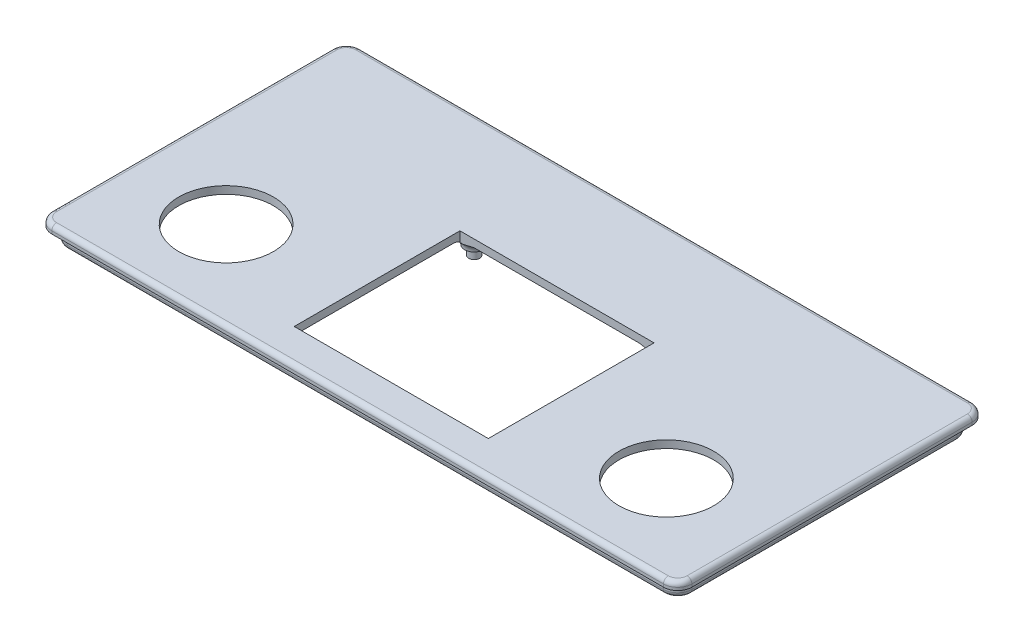
from build123d import *

# Parameters (mm, degrees)
SKETCH1_W           = 132
SKETCH1_H           = 62
SKETCH1_W_2         = 128.8
SKETCH1_H_2         = 58.8
BOSS_EXTRUDE1_DEPTH = 3
SKETCH3_W           = 135.2
SKETCH3_H           = 65.2
BOSS_EXTRUDE3_DEPTH = 1.6
FILLET2_R           = 3
CUT_EXTRUDE1_REACH  = 77.191
SKETCH4_R           = 10
FILLET3_R           = 1
FILLET4_R           = 1
CUT_EXTRUDE2_REACH  = 77.191
SKETCH5_W           = 41
SKETCH5_H           = 35
SKETCH6_R           = 2
BOSS_EXTRUDE4_DEPTH = 2
SKETCH7_R           = 1.15
BOSS_EXTRUDE5_DEPTH = 2
FILLET5_R           = 2


with BuildPart() as part:
    # Sketch1 → Boss-Extrude1 (new body)
    with BuildSketch(Plane(origin=(0, 0, 0), x_dir=(1, 0, 0), z_dir=(0, 1, 0))):
        Rectangle(SKETCH1_W, SKETCH1_H)
        Rectangle(SKETCH1_W_2, SKETCH1_H_2, mode=Mode.SUBTRACT)
    extrude(amount=BOSS_EXTRUDE1_DEPTH)

    # Sketch3 → Boss-Extrude3 (add)
    with BuildSketch(Plane(origin=(0, 3, 0), x_dir=(1, 0, 0), z_dir=(0, 1, 0))):
        Rectangle(SKETCH3_W, SKETCH3_H)
    extrude(amount=BOSS_EXTRUDE3_DEPTH)

    # Fillet2
    fillet2_edges = [part.edges().sort_by_distance(p)[0] for p in [
        (-64.4, 1.5, 29.4),
        (64.4, 1.5, 29.4),
        (64.4, 1.5, -29.4),
        (-64.4, 1.5, -29.4),
        (-67.6, 3.8, 32.6),
        (67.6, 3.8, 32.6),
        (67.6, 3.8, -32.6),
        (-67.6, 3.8, -32.6),
        (66, 1.5, 31),
        (-66, 1.5, 31),
        (-66, 1.5, -31),
        (66, 1.5, -31),
    ]]
    fillet(fillet2_edges, radius=FILLET2_R)

    # Sketch4 → Cut-Extrude1 (cut, up to next)
    with BuildSketch(Plane(origin=(0, 4.6, 0), x_dir=(1, 0, 0), z_dir=(0, 1, 0)), mode=Mode.PRIVATE) as cut_extrude1_sk1:
        with Locations(Location((-46.3929, -14, 0), (0, 0, 270))):
            Circle(SKETCH4_R)
    cut_extrude1_tool1 = extrude(cut_extrude1_sk1.sketch, amount=-CUT_EXTRUDE1_REACH, mode=Mode.PRIVATE) & part.part
    # Sketch4 → Cut-Extrude1 (cut, up to next)
    with BuildSketch(Plane(origin=(0, 4.6, 0), x_dir=(1, 0, 0), z_dir=(0, 1, 0)), mode=Mode.PRIVATE) as cut_extrude1_sk2:
        with Locations(Location((46.6071, -14, 0), (0, 0, 270))):
            Circle(SKETCH4_R)
    cut_extrude1_tool2 = extrude(cut_extrude1_sk2.sketch, amount=-CUT_EXTRUDE1_REACH, mode=Mode.PRIVATE) & part.part
    add(cut_extrude1_tool1.solids().sort_by_distance((-46.3929, 4.6, 14))[0], mode=Mode.SUBTRACT)
    add(cut_extrude1_tool2.solids().sort_by_distance((46.6071, 4.6, 14))[0], mode=Mode.SUBTRACT)

    # Fillet3
    fillet3_edges = [part.edges().sort_by_distance(p)[0] for p in [
        (0, 4.6, -32.6),
        (67.6, 4.6, 0),
        (0, 4.6, 32.6),
        (-67.6, 4.6, 0),
        (-66.721320344, 4.6, 31.721320344),
        (-66.721320344, 4.6, -31.721320344),
        (66.721320344, 4.6, 31.721320344),
        (66.721320344, 4.6, -31.721320344),
    ]]
    fillet(fillet3_edges, radius=FILLET3_R)

    # Fillet4
    fillet4_edges = [part.edges().sort_by_distance(p)[0] for p in [
        (0, 0, -31),
        (66, 0, 0),
        (0, 0, 31),
        (-66, 0, 0),
        (-65.121320344, 0, 30.121320344),
        (-65.121320344, 0, -30.121320344),
        (65.121320344, 0, 30.121320344),
        (65.121320344, 0, -30.121320344),
    ]]
    fillet(fillet4_edges, radius=FILLET4_R)

    # Sketch5 → Cut-Extrude2 (cut, up to next)
    with BuildSketch(Plane(origin=(0, 4.6, 0), x_dir=(1, 0, 0), z_dir=(0, 1, 0)), mode=Mode.PRIVATE) as cut_extrude2_sk1:
        with Locations((0, -8)):
            Rectangle(SKETCH5_W, SKETCH5_H)
    cut_extrude2_tool1 = extrude(cut_extrude2_sk1.sketch, amount=-CUT_EXTRUDE2_REACH, mode=Mode.PRIVATE) & part.part
    add(cut_extrude2_tool1.solids().sort_by_distance((0, 4.6, 8))[0], mode=Mode.SUBTRACT)

    # Sketch6 → Boss-Extrude4 (add)
    with BuildSketch(Plane.XZ.offset(-3)):
        with Locations(Location((-20.125, -12.133753118, 0), (0, 0, 90))):
            Circle(SKETCH6_R)
        with Locations((-20.125, 27.639510402)):
            Circle(SKETCH6_R)
        with Locations((20.125, 27.639510402)):
            Circle(SKETCH6_R)
        with Locations(Location((20.125, -12.133753118, 0), (0, 0, 90))):
            Circle(SKETCH6_R)
    extrude(amount=BOSS_EXTRUDE4_DEPTH)

    # Sketch7 → Boss-Extrude5 (add)
    with BuildSketch(Plane.XZ.offset(-1)):
        with Locations(Location((-20.125, 27.639510402, 0), (0, 0, 270))):
            Circle(SKETCH7_R)
        with Locations(Location((20.125, 27.639510402, 0), (0, 0, 270))):
            Circle(SKETCH7_R)
        with Locations(Location((-20.125, -12.133753118, 0), (0, 0, 270))):
            Circle(SKETCH7_R)
        with Locations(Location((20.125, -12.133753118, 0), (0, 0, 270))):
            Circle(SKETCH7_R)
    extrude(amount=BOSS_EXTRUDE5_DEPTH)

    # Fillet5
    # the kernel refuses this fillet: 2 mm, written as the material it adds along each edge
    with BuildSketch(Plane(origin=(20.125, 3, 27.639510402), x_dir=(0.003141587485838926, 0, 0.9999950652018583), z_dir=(-0.9999950652018583, 0, 0.003141587485838926))) as fillet5_piece_1_section:
        with BuildLine():
            CenterArc((2 + FILLET5_R, -FILLET5_R), FILLET5_R, 90, 90)
            Line((2, -FILLET5_R), (2, 0))
            Line((2, 0), (2 + FILLET5_R, 0))
        make_face()
    fillet5_piece_1 = revolve(axis=Axis((20.125, 3, 27.639510402), (0, 1, 0)), revolution_arc=359.64, mode=Mode.PRIVATE)
    fillet5_piece_1 = split(fillet5_piece_1, bisect_by=Plane(origin=(22.155432761, 2.539514878, 29.4), z_dir=(0, 0, -1)), keep=Keep.TOP, mode=Mode.PRIVATE)
    fillet5_piece_1 = split(fillet5_piece_1, bisect_by=Plane(origin=(22.155432761, 2.539514878, 25.5), z_dir=(0, 0, 1)), keep=Keep.TOP, mode=Mode.PRIVATE)
    add(fillet5_piece_1)
    with BuildSketch(Plane(origin=(20.125, 3, 27.639510402), x_dir=(0.003141587485838926, 0, 0.9999950652018583), z_dir=(-0.9999950652018583, 0, 0.003141587485838926))) as fillet5_piece_2_section:
        with BuildLine():
            CenterArc((2 + FILLET5_R, -FILLET5_R), FILLET5_R, 90, 90)
            Line((2, -FILLET5_R), (2, 0))
            Line((2, 0), (2 + FILLET5_R, 0))
        make_face()
    fillet5_piece_2 = revolve(axis=Axis((20.125, 3, 27.639510402), (0, 1, 0)), revolution_arc=359.64, mode=Mode.PRIVATE)
    fillet5_piece_2 = split(fillet5_piece_2, bisect_by=Plane(origin=(20.5, 2.773825657, 25.100890484), z_dir=(1, 0, 0)), keep=Keep.TOP, mode=Mode.PRIVATE)
    fillet5_piece_2 = split(fillet5_piece_2, bisect_by=Plane(origin=(21.236754387, 2.773825657, 25.5), z_dir=(0, 0, -1)), keep=Keep.TOP, mode=Mode.PRIVATE)
    add(fillet5_piece_2)
    with BuildSketch(Plane(origin=(-20.125, 3, 27.639510402), x_dir=(0.0031415874858371495, 0, 0.9999950652018583), z_dir=(-0.9999950652018583, 0, 0.0031415874858371495))) as fillet5_piece_3_section:
        with BuildLine():
            CenterArc((2 + FILLET5_R, -FILLET5_R), FILLET5_R, 90, 90)
            Line((2, -FILLET5_R), (2, 0))
            Line((2, 0), (2 + FILLET5_R, 0))
        make_face()
    fillet5_piece_3 = revolve(axis=Axis((-20.125, 3, 27.639510402), (0, 1, 0)), revolution_arc=359.64, mode=Mode.PRIVATE)
    fillet5_piece_3 = split(fillet5_piece_3, bisect_by=Plane(origin=(-17.69928118, 2.425603433, 29.4), z_dir=(0, 0, -1)), keep=Keep.TOP, mode=Mode.PRIVATE)
    fillet5_piece_3 = split(fillet5_piece_3, bisect_by=Plane(origin=(-17.69928118, 2.425603433, 25.5), z_dir=(0, 0, 1)), keep=Keep.TOP, mode=Mode.PRIVATE)
    add(fillet5_piece_3)
    with BuildSketch(Plane(origin=(-20.125, 3, 27.639510402), x_dir=(0.0031415874858371495, 0, 0.9999950652018583), z_dir=(-0.9999950652018583, 0, 0.0031415874858371495))) as fillet5_piece_4_section:
        with BuildLine():
            CenterArc((2 + FILLET5_R, -FILLET5_R), FILLET5_R, 90, 90)
            Line((2, -FILLET5_R), (2, 0))
            Line((2, 0), (2 + FILLET5_R, 0))
        make_face()
    fillet5_piece_4 = revolve(axis=Axis((-20.125, 3, 27.639510402), (0, 1, 0)), revolution_arc=359.64, mode=Mode.PRIVATE)
    fillet5_piece_4 = split(fillet5_piece_4, bisect_by=Plane(origin=(-21.236754422, 2.773825532, 25.5), z_dir=(0, 0, -1)), keep=Keep.TOP, mode=Mode.PRIVATE)
    fillet5_piece_4 = split(fillet5_piece_4, bisect_by=Plane(origin=(-20.5, 2.773825532, 25.100890528), z_dir=(-1, 0, 0)), keep=Keep.TOP, mode=Mode.PRIVATE)
    add(fillet5_piece_4)
    with BuildSketch(Plane(origin=(-20.125, 3, -12.133753118), x_dir=(0, 0, 1), z_dir=(1, 0, 0))) as fillet5_piece_5_section:
        with BuildLine():
            CenterArc((2 + FILLET5_R, FILLET5_R), FILLET5_R, 180, 90)
            Line((2, FILLET5_R), (2, 0))
            Line((2, 0), (2 + FILLET5_R, 0))
        make_face()
    fillet5_piece_5 = revolve(axis=Axis((-20.125, 3, -12.133753118), (0, -1, 0)), mode=Mode.PRIVATE)
    fillet5_piece_5 = split(fillet5_piece_5, bisect_by=Plane(origin=(-20.327948227, 1.82031668, -9.5), z_dir=(0, 0, -1)), keep=Keep.TOP, mode=Mode.PRIVATE)
    add(fillet5_piece_5)
    with BuildSketch(Plane(origin=(-20.125, 3, -12.133753118), x_dir=(0, 0, 1), z_dir=(1, 0, 0))) as fillet5_piece_6_section:
        with BuildLine():
            CenterArc((2 + FILLET5_R, FILLET5_R), FILLET5_R, 180, 90)
            Line((2, FILLET5_R), (2, 0))
            Line((2, 0), (2 + FILLET5_R, 0))
        make_face()
    fillet5_piece_6 = revolve(axis=Axis((-20.125, 3, -12.133753118), (0, -1, 0)), mode=Mode.PRIVATE)
    fillet5_piece_6 = split(fillet5_piece_6, bisect_by=Plane(origin=(-20.5, 2.890749486, -9.205697252), z_dir=(-1, 0, 0)), keep=Keep.TOP, mode=Mode.PRIVATE)
    add(fillet5_piece_6)
    with BuildSketch(Plane(origin=(20.125, 3, -12.133753118), x_dir=(0, 0, 1), z_dir=(1, 0, 0))) as fillet5_piece_7_section:
        with BuildLine():
            CenterArc((2 + FILLET5_R, FILLET5_R), FILLET5_R, 180, 90)
            Line((2, FILLET5_R), (2, 0))
            Line((2, 0), (2 + FILLET5_R, 0))
        make_face()
    fillet5_piece_7 = revolve(axis=Axis((20.125, 3, -12.133753118), (0, -1, 0)), mode=Mode.PRIVATE)
    fillet5_piece_7 = split(fillet5_piece_7, bisect_by=Plane(origin=(17.564077298, 2.427646473, -9.5), z_dir=(0, 0, -1)), keep=Keep.TOP, mode=Mode.PRIVATE)
    add(fillet5_piece_7)
    with BuildSketch(Plane(origin=(20.125, 3, -12.133753118), x_dir=(0, 0, 1), z_dir=(1, 0, 0))) as fillet5_piece_8_section:
        with BuildLine():
            CenterArc((2 + FILLET5_R, FILLET5_R), FILLET5_R, 180, 90)
            Line((2, FILLET5_R), (2, 0))
            Line((2, 0), (2 + FILLET5_R, 0))
        make_face()
    fillet5_piece_8 = revolve(axis=Axis((20.125, 3, -12.133753118), (0, -1, 0)), mode=Mode.PRIVATE)
    fillet5_piece_8 = split(fillet5_piece_8, bisect_by=Plane(origin=(20.5, 2.890749599, -9.205696985), z_dir=(1, 0, 0)), keep=Keep.TOP, mode=Mode.PRIVATE)
    add(fillet5_piece_8)


solid = part.part
